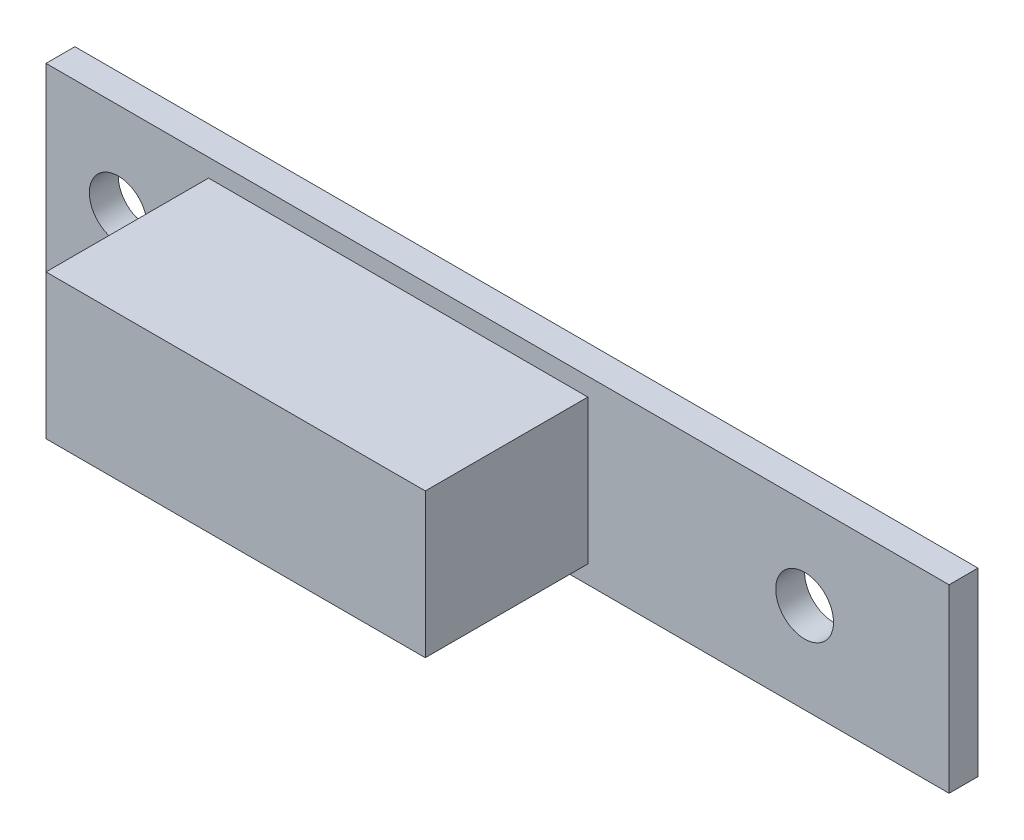
from build123d import *

# Parameters (mm, degrees)
SKETCH1_W           = 50
SKETCH1_H           = 10
SKETCH1_R           = 1.6
BOSS_EXTRUDE1_DEPTH = 1.6
SKETCH2_W           = 21
SKETCH2_H           = 8
BOSS_EXTRUDE2_DEPTH = 9


with BuildPart() as part:
    # Sketch1 → Boss-Extrude1 (new body)
    with BuildSketch(Plane.XY):
        with Locations((25, 5)):
            Rectangle(SKETCH1_W, SKETCH1_H)
        with Locations((4, 5)):
            Circle(SKETCH1_R, mode=Mode.SUBTRACT)
        with Locations((42, 5)):
            Circle(SKETCH1_R, mode=Mode.SUBTRACT)
    extrude(amount=BOSS_EXTRUDE1_DEPTH)

    # Sketch2 → Boss-Extrude2 (add)
    with BuildSketch(Plane.XY.offset(1.6)):
        with Locations((19.5, 5)):
            Rectangle(SKETCH2_W, SKETCH2_H)
    extrude(amount=BOSS_EXTRUDE2_DEPTH)


solid = part.part
